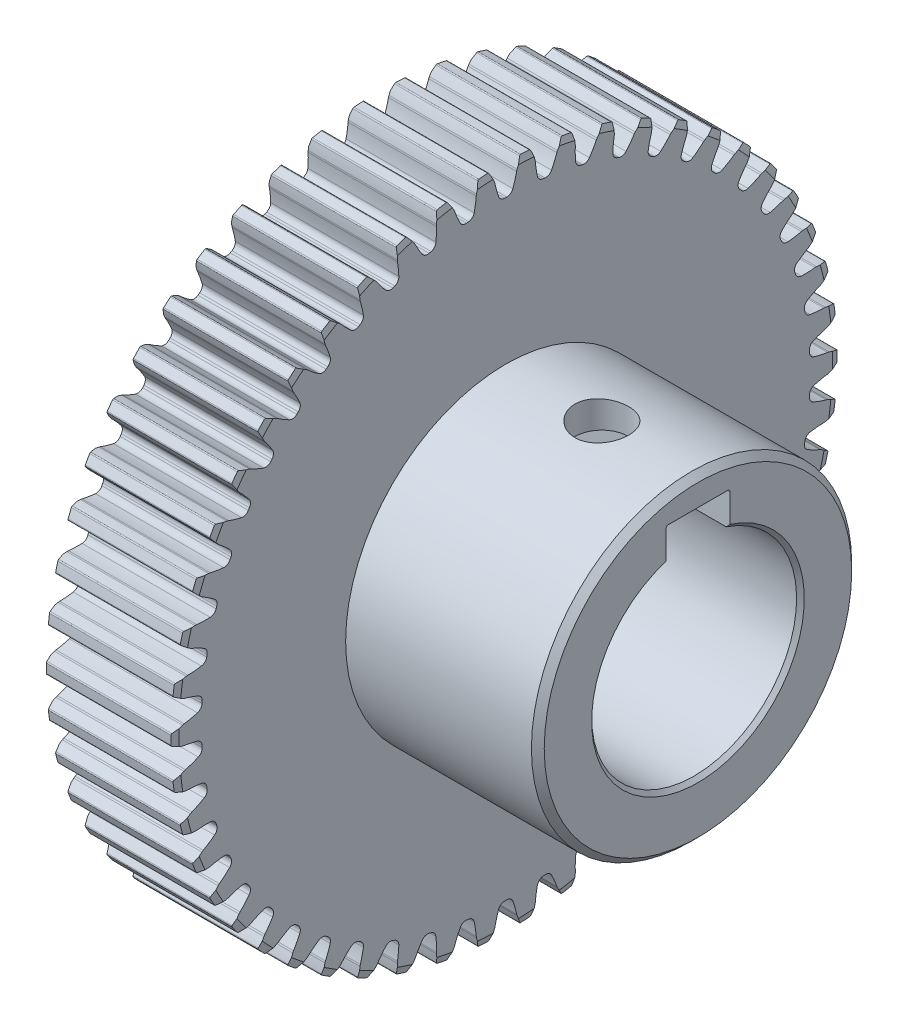
from build123d import *

# Parameters (mm, degrees)
CUT_EXTRUDE1_DEPTH     = 39.105117767
CIRPATTERN1_COUNT      = 50
SKETCH3_W              = 15
SKETCH3_H              = 12.5
SKETCH4_R              = 8
CUT_EXTRUDE2_DEPTH     = 45.444923933
CHAMFER1_SIZE          = 0.3
CHAMFER2_SIZE          = 0.5
TAPPED_START           = 7.719455838
TAPPED_HOLE2_OUTLINE_R = 2.1
TAPPED_HOLE2_DEPTH     = 4.7805441
CUT_EXTRUDE3_DEPTH     = 45.444923933


# Read off the part's stored shape, not the designer's step: Tapped Hole2
with BuildPart() as part:
    # Sketch1 → Revolve1 (revolve)
    with BuildSketch(Plane.XY, mode=Mode.PRIVATE) as revolve1_sk:
        Polygon((0, 0), (0, 25.5), (0.133974596, 26), (9.866025404, 26), (10, 25.5), (10, 0), align=None)
    revolve(revolve1_sk.sketch.rotate(Axis((0, 0, 0), (1, 0, 0)), 90), axis=Axis((0, 0, 0), (1, 0, 0)))

    # Sketch2 → Cut-Extrude1 (cut, through all)
    with BuildSketch(Plane(origin=(0, 0, 0), x_dir=(0, 0, -1), z_dir=(1, 0, 0))):
        with BuildLine():
            ThreePointArc((0.081831742, 23.749859022), (0, 23.75), (-0.081831742, 23.749859022))
            ThreePointArc((-0.081831742, 23.749859022), (-0.370482256, 23.840377762), (-0.55410257, 24.08078646))
            ThreePointArc((-0.55410257, 24.08078646), (-0.716435644, 24.586888591), (-0.84343302, 25.102992322))
            ThreePointArc((-0.84343302, 25.102992322), (-0.859389808, 25.16544205), (-0.880705226, 25.226271653))
            ThreePointArc((-0.880705226, 25.226271653), (-1.028793654, 25.573496863), (-1.192454823, 25.913659399))
            ThreePointArc((-1.192454823, 25.913659399), (-1.231432075, 25.954801123), (-1.286510528, 25.968151468))
            ThreePointArc((-1.286510528, 25.968151468), (0, 26), (1.286510528, 25.968151468))
            ThreePointArc((1.286510528, 25.968151468), (1.231432075, 25.954801123), (1.192454823, 25.913659399))
            ThreePointArc((1.192454823, 25.913659399), (1.028793654, 25.573496863), (0.880705226, 25.226271653))
            ThreePointArc((0.880705226, 25.226271653), (0.859389808, 25.16544205), (0.84343302, 25.102992322))
            ThreePointArc((0.84343302, 25.102992322), (0.716435644, 24.586888591), (0.55410257, 24.08078646))
            ThreePointArc((0.55410257, 24.08078646), (0.370482256, 23.840377762), (0.081831742, 23.749859022))
        make_face()
    cut_extrude1 = extrude(amount=CUT_EXTRUDE1_DEPTH, mode=Mode.SUBTRACT)

    # CirPattern1: Cut-Extrude1 ×50 about axis
    cirpattern1_axis = Axis((0, 0, 0), (1, 0, 0))
    for i in range(1, CIRPATTERN1_COUNT):
        add(cut_extrude1.rotate(cirpattern1_axis, i * 360 / CIRPATTERN1_COUNT), mode=Mode.SUBTRACT)

    # Sketch3 → Revolve2 (revolve)
    with BuildSketch(Plane.XY, mode=Mode.PRIVATE) as revolve2_sk:
        with Locations((17.5, 6.25)):
            Rectangle(SKETCH3_W, SKETCH3_H)
    revolve(revolve2_sk.sketch.rotate(Axis((0, 0, 0), (1, 0, 0)), 90), axis=Axis((0, 0, 0), (1, 0, 0)))

    # Sketch4 → Cut-Extrude2 (cut, through all)
    with BuildSketch(Plane.ZY):
        Circle(SKETCH4_R)
    extrude(amount=-CUT_EXTRUDE2_DEPTH, mode=Mode.SUBTRACT)

    # Chamfer1
    chamfer1_edges = [part.edges().sort_by_distance(p)[0] for p in [
        (25, 0, -8),
        (0, 0, -8),
    ]]
    chamfer(chamfer1_edges, length=CHAMFER1_SIZE)

    # Chamfer2
    chamfer2_edges = [part.edges().sort_by_distance(p)[0] for p in [
        (25, 0, -12.5),
    ]]
    chamfer(chamfer2_edges, length=CHAMFER2_SIZE)

    # Tapped Hole2 outline → Tapped Hole2 (cut)
    with BuildSketch(Plane(origin=(0, 0, 0), x_dir=(1, 0, 0), z_dir=(0, 1, 0)).offset(TAPPED_START)):
        with Locations((17.5, 0)):
            Circle(TAPPED_HOLE2_OUTLINE_R)
    extrude(amount=TAPPED_HOLE2_DEPTH, mode=Mode.SUBTRACT)

    # Sketch9 → Cut-Extrude3 (cut, through all)
    with BuildSketch(Plane(origin=(0, 0, 0), x_dir=(0, 0, -1), z_dir=(1, 0, 0))):
        with BuildLine():
            Line((2.5, 0), (2.5, 10.1))
            ThreePointArc((2.5, 10.1), (2.441421356, 10.241421356), (2.3, 10.3))
            Line((2.3, 10.3), (-2.3, 10.3))
            ThreePointArc((-2.3, 10.3), (-2.441421356, 10.241421356), (-2.5, 10.1))
            Line((-2.5, 10.1), (-2.5, 0))
            Line((-2.5, 0), (2.5, 0))
        make_face()
    extrude(amount=CUT_EXTRUDE3_DEPTH, mode=Mode.SUBTRACT)


solid = part.part
